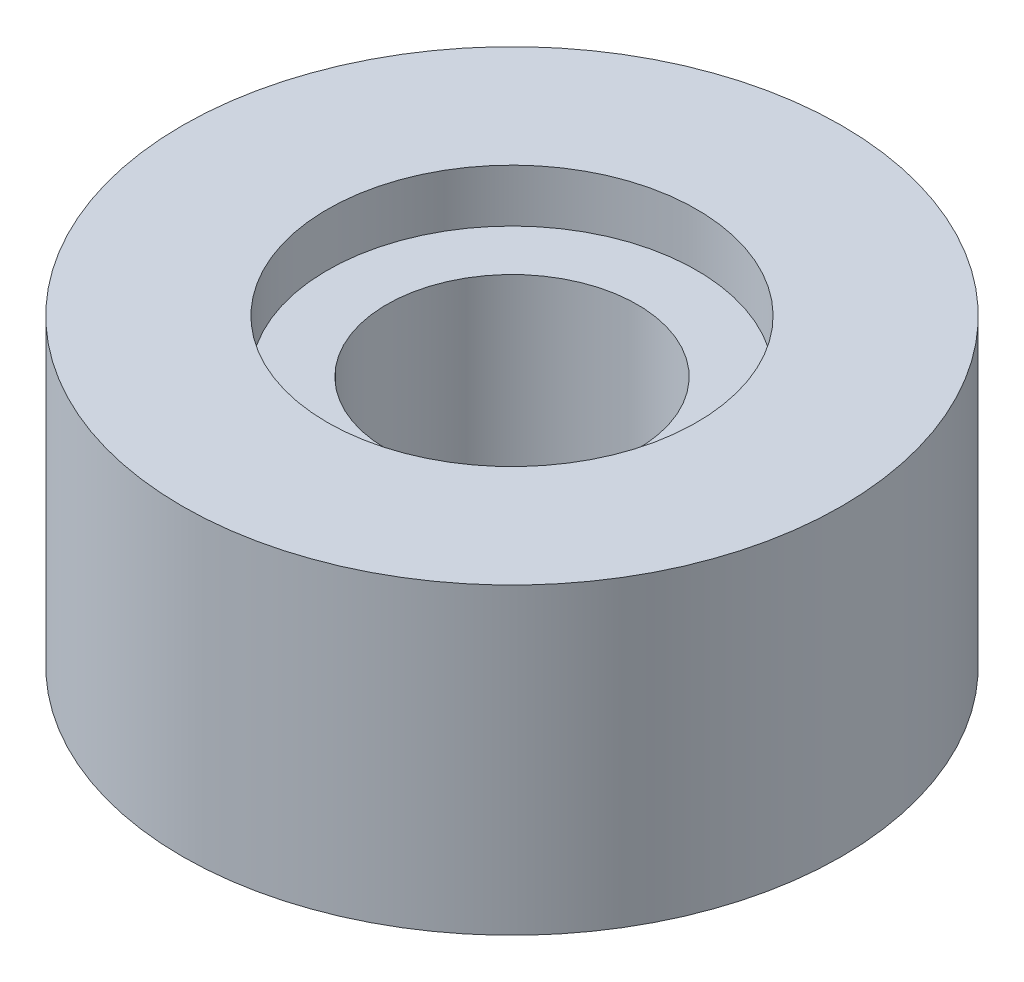
from build123d import *

# Parameters (mm, degrees)
SKETCH1_R           = 25
SKETCH1_R_2         = 9.5
BOSS_EXTRUDE1_DEPTH = 15
SKETCH2_R           = 25
SKETCH2_R_2         = 14
BOSS_EXTRUDE2_DEPTH = 4


with BuildPart() as part:
    # Sketch1 → Boss-Extrude1 (new body)
    with BuildSketch(Plane(origin=(0, 0, 0), x_dir=(1, 0, 0), z_dir=(0, 1, 0))):
        Circle(SKETCH1_R)
        Circle(SKETCH1_R_2, mode=Mode.SUBTRACT)
    extrude(amount=BOSS_EXTRUDE1_DEPTH)

    # Sketch2 → Boss-Extrude2 (add)
    with BuildSketch(Plane(origin=(0, 15, 0), x_dir=(1, 0, 0), z_dir=(0, 1, 0))):
        Circle(SKETCH2_R)
        Circle(SKETCH2_R_2, mode=Mode.SUBTRACT)
    boss_extrude2 = extrude(amount=BOSS_EXTRUDE2_DEPTH)

    # Mirror1: Boss-Extrude2 across plane
    add(boss_extrude2.mirror(Plane.ZX.offset(7.5)))


solid = part.part
